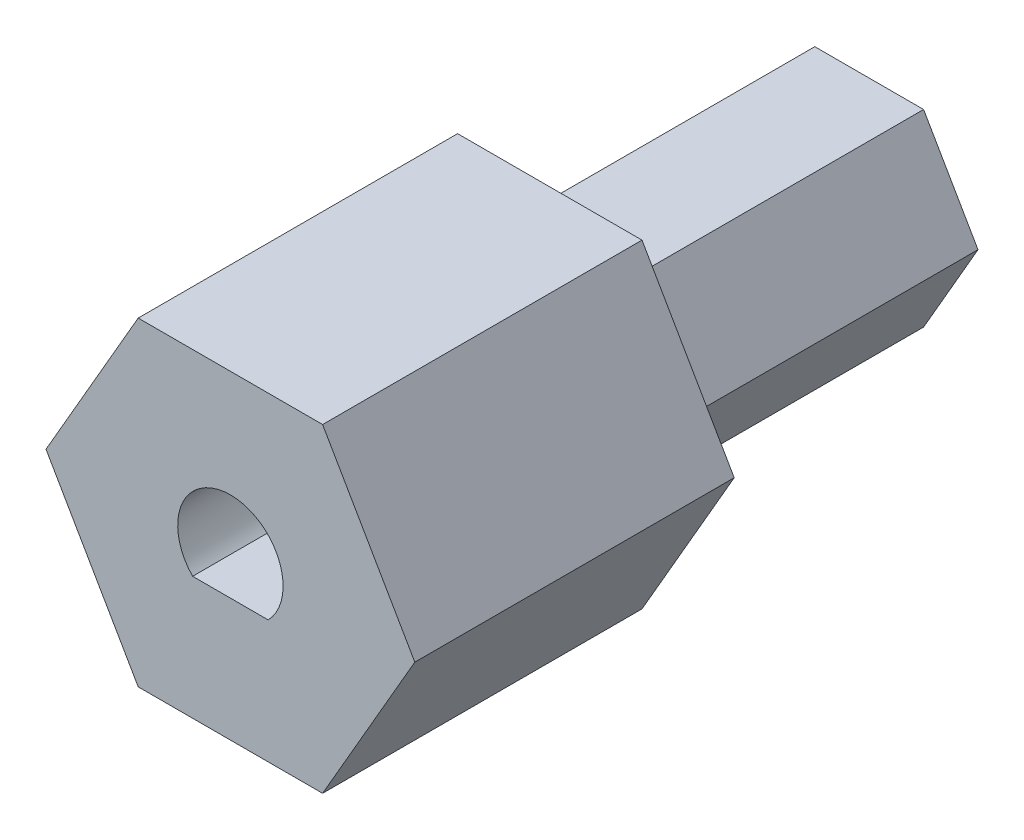
from build123d import *

# Parameters (mm, degrees)
BOSS_EXTRUDE1_DEPTH = 20
BOSS_EXTRUDE2_DEPTH = 10
CUT_EXTRUDE1_DEPTH  = 11


with BuildPart() as part:
    # Sketch1 → Boss-Extrude1 (new body)
    with BuildSketch(Plane.XY):
        Polygon((3.406366588, 0), (1.703183294, 2.95), (-1.703183294, 2.95), (-3.406366588, 0), (-1.703183294, -2.95), (1.703183294, -2.95), align=None)
    extrude(amount=BOSS_EXTRUDE1_DEPTH)

    # Sketch2 → Boss-Extrude2 (add)
    with BuildSketch(Plane.XY.offset(20)):
        Polygon((-5.773502692, 0), (-2.886751346, -5), (2.886751346, -5), (5.773502692, 0), (2.886751346, 5), (-2.886751346, 5), align=None)
    extrude(amount=-BOSS_EXTRUDE2_DEPTH)

    # Sketch4 → Cut-Extrude1 (cut)
    with BuildSketch(Plane.XY.offset(20)):
        with BuildLine():
            Line((-1.183215957, -1.15), (1.183215957, -1.15))
            ThreePointArc((1.183215957, -1.15), (0, 1.65), (-1.183215957, -1.15))
        make_face()
    extrude(amount=-CUT_EXTRUDE1_DEPTH, mode=Mode.SUBTRACT)


solid = part.part
